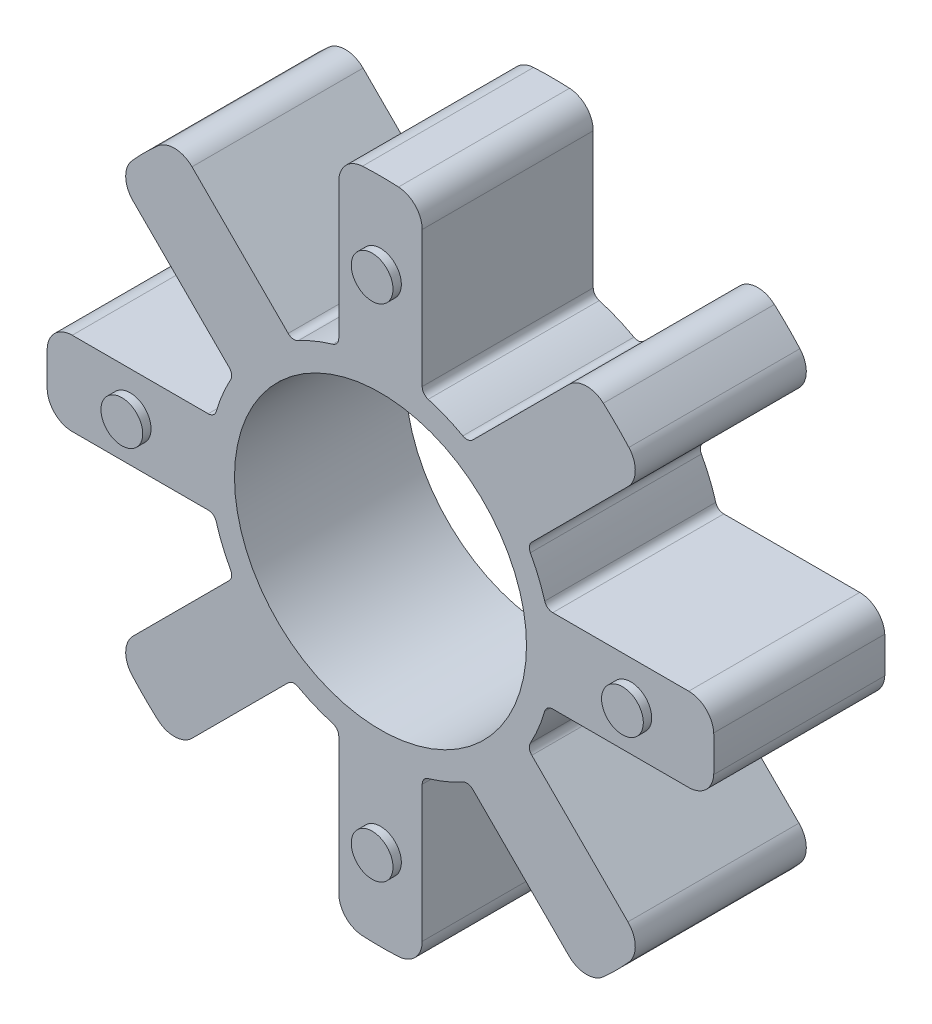
from build123d import *

# Parameters (mm, degrees)
SKETCH1_R           = 17.5
BOSS_EXTRUDE1_DEPTH = 10.25
FILLET1_R           = 1
FILLET2_R           = 3
SKETCH2_R           = 2.5
BOSS_EXTRUDE2_DEPTH = 11.25


with BuildPart() as part:
    # Sketch1 → Boss-Extrude1 (new, symmetric)
    with BuildSketch(Plane.XY):
        with BuildLine():
            Line((-5, 39.686269666), (-5, 19.880895352))
            ThreePointArc((-5, 19.880895352), (-7.845010363, 18.939530416), (-10.522382014, 17.593449825))
            Line((-10.522382014, 17.593449825), (-24.526896495, 31.597964307))
            ThreePointArc((-24.526896495, 31.597964307), (-28.284271247, 28.284271247), (-31.597964307, 24.526896495))
            Line((-31.597964307, 24.526896495), (-17.593449825, 10.522382014))
            ThreePointArc((-17.593449825, 10.522382014), (-18.939530416, 7.845010363), (-19.880895352, 5))
            Line((-19.880895352, 5), (-39.686269666, 5))
            ThreePointArc((-39.686269666, 5), (-40, 0), (-39.686269666, -5))
            Line((-39.686269666, -5), (-19.880895352, -5))
            ThreePointArc((-19.880895352, -5), (-18.939530416, -7.845010363), (-17.593449825, -10.522382014))
            Line((-17.593449825, -10.522382014), (-31.597964307, -24.526896495))
            ThreePointArc((-31.597964307, -24.526896495), (-28.284271247, -28.284271247), (-24.526896495, -31.597964307))
            Line((-24.526896495, -31.597964307), (-10.522382014, -17.593449825))
            ThreePointArc((-10.522382014, -17.593449825), (-7.845010363, -18.939530416), (-5, -19.880895352))
            Line((-5, -19.880895352), (-5, -39.686269666))
            ThreePointArc((-5, -39.686269666), (0, -40), (5, -39.686269666))
            Line((5, -39.686269666), (5, -19.880895352))
            ThreePointArc((5, -19.880895352), (7.845010363, -18.939530416), (10.522382014, -17.593449825))
            Line((10.522382014, -17.593449825), (24.526896495, -31.597964307))
            ThreePointArc((24.526896495, -31.597964307), (28.284271247, -28.284271247), (31.597964307, -24.526896495))
            Line((31.597964307, -24.526896495), (17.593449825, -10.522382014))
            ThreePointArc((17.593449825, -10.522382014), (18.939530416, -7.845010363), (19.880895352, -5))
            Line((19.880895352, -5), (39.686269666, -5))
            ThreePointArc((39.686269666, -5), (40, 0), (39.686269666, 5))
            Line((39.686269666, 5), (19.880895352, 5))
            ThreePointArc((19.880895352, 5), (18.939530416, 7.845010363), (17.593449825, 10.522382014))
            Line((17.593449825, 10.522382014), (31.597964307, 24.526896495))
            ThreePointArc((31.597964307, 24.526896495), (28.284271247, 28.284271247), (24.526896495, 31.597964307))
            Line((24.526896495, 31.597964307), (10.522382014, 17.593449825))
            ThreePointArc((10.522382014, 17.593449825), (7.845010363, 18.939530416), (5, 19.880895352))
            Line((5, 19.880895352), (5, 39.686269666))
            ThreePointArc((5, 39.686269666), (0, 40), (-5, 39.686269666))
        make_face()
        Circle(SKETCH1_R, mode=Mode.SUBTRACT)
    extrude(amount=BOSS_EXTRUDE1_DEPTH, both=True)

    # Fillet1
    fillet1_edges = [part.edges().sort_by_distance(p)[0] for p in [
        (-10.522382014, 17.593449825, 0),
        (-5, 19.880895352, 0),
        (-17.593449825, 10.522382014, 0),
        (-19.880895352, 5, 0),
        (-19.880895352, -5, 0),
        (-17.593449825, -10.522382014, 0),
        (-5, -19.880895352, 0),
        (-10.522382014, -17.593449825, 0),
        (5, -19.880895352, 0),
        (10.522382014, -17.593449825, 0),
        (17.593449825, -10.522382014, 0),
        (19.880895352, -5, 0),
        (19.880895352, 5, 0),
        (17.593449825, 10.522382014, 0),
        (10.522382014, 17.593449825, 0),
        (5, 19.880895352, 0),
    ]]
    fillet(fillet1_edges, radius=FILLET1_R)

    # Fillet2
    fillet2_edges = [part.edges().sort_by_distance(p)[0] for p in [
        (31.597964307, -24.526896495, 0),
        (24.526896495, -31.597964307, 0),
        (5, -39.686269666, 0),
        (-5, -39.686269666, 0),
        (-24.526896495, -31.597964307, 0),
        (-31.597964307, -24.526896495, 0),
        (-39.686269666, -5, 0),
        (-39.686269666, 5, 0),
        (-31.597964307, 24.526896495, 0),
        (-24.526896495, 31.597964307, 0),
        (-5, 39.686269666, 0),
        (5, 39.686269666, 0),
        (24.526896495, 31.597964307, 0),
        (31.597964307, 24.526896495, 0),
        (39.686269666, -5, 0),
        (39.686269666, 5, 0),
    ]]
    fillet(fillet2_edges, radius=FILLET2_R)

    # Sketch2 → Boss-Extrude2 (add, symmetric)
    with BuildSketch(Plane.XY):
        with Locations((-30, 0)):
            Circle(SKETCH2_R)
        with Locations((0, 30)):
            Circle(SKETCH2_R)
        with Locations((30, 0)):
            Circle(SKETCH2_R)
        with Locations((0, -30)):
            Circle(SKETCH2_R)
    extrude(amount=BOSS_EXTRUDE2_DEPTH, both=True)


solid = part.part
